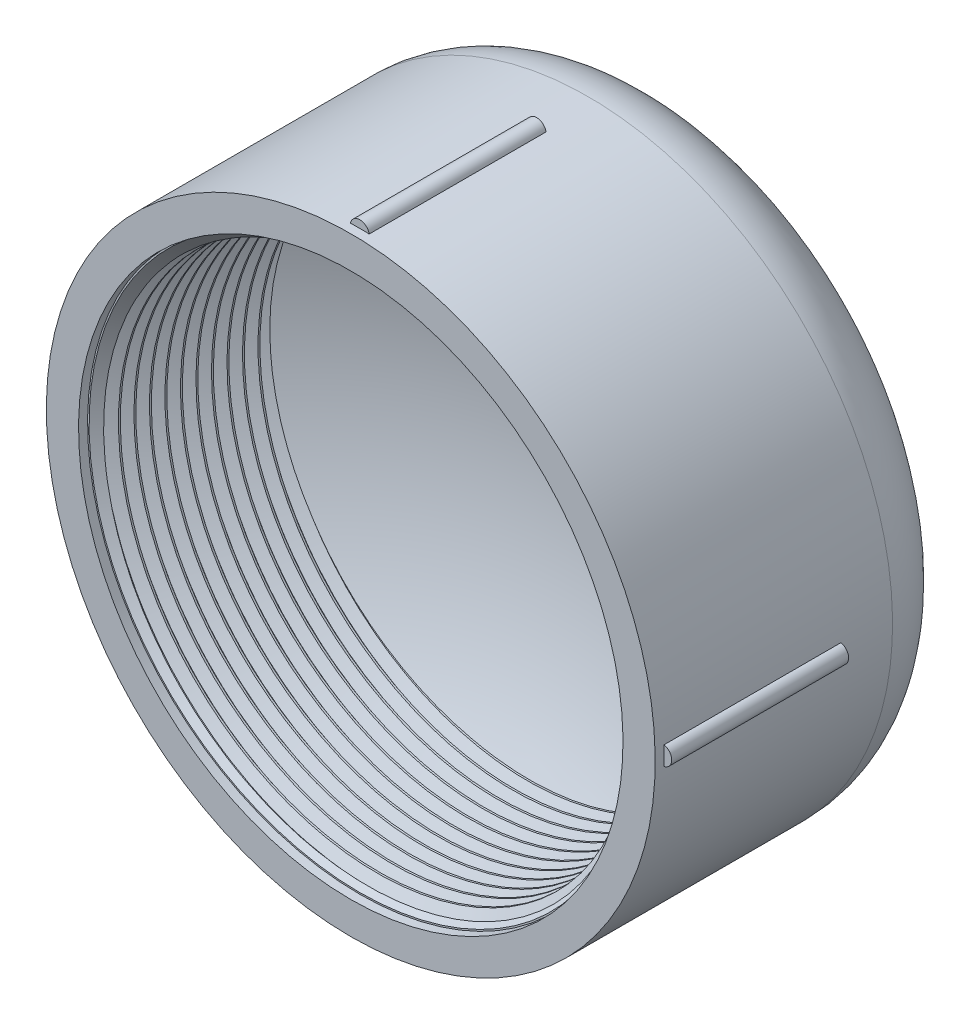
from build123d import *

# Parameters (mm, degrees)
FILLET1_R              = 15.875
BOSS_EXTRUDE1_START    = -37.338
BOSS_EXTRUDE1_DEPTH    = 37.338
CIRPATTERN1_COUNT      = 4
SKETCH5_R              = 57.4675
BOSS_EXTRUDE2_DEPTH    = 35.433
SKETCH6_R              = 57.15
BOSS_EXTRUDE3_DEPTH    = 35.433
BOSS_EXTRUDE3_DRAFT    = -1.783333333
CUT_SWEEP1_PITCH       = 3.17653854
CUT_SWEEP1_HEIGHT      = 39.116
CUT_SWEEP1_RADIUS      = 57.15
CUT_SWEEP1_START_ANGLE = 90


with BuildPart() as part:
    # Sketch2 → Revolve1 (revolve)
    with BuildSketch(Plane(origin=(0, 0, 0), x_dir=(0, 0, -1), z_dir=(1, 0, 0))):
        with BuildLine():
            Line((-37.719, -64.262), (22.6314, -64.262))
            ThreePointArc((22.6314, -64.262), (33.89650561, -33.004697839), (37.719, 0))
            Line((37.719, 0), (14.143642192, 0))
            ThreePointArc((14.143642192, 0), (10.696674637, -28.654184307), (0.55245, -55.673410242))
            Line((0.55245, -55.673410242), (-0.381, -55.673410242))
            Line((-0.381, -55.673410242), (-0.381, -56.046790242))
            Line((-0.381, -56.046790242), (-35.814, -57.15))
            Line((-35.814, -57.15), (-35.814, -57.4675))
            Line((-35.814, -57.4675), (-37.719, -57.4675))
            Line((-37.719, -57.4675), (-37.719, -64.262))
        make_face()
    revolve(axis=Axis((0, 0, 37.719), (0, 0, -1)))

    # Fillet1
    fillet1_edges = [part.edges().sort_by_distance(p)[0] for p in [
        (0, 64.262, -22.6314),
    ]]
    fillet(fillet1_edges, radius=FILLET1_R)

    # Sketch4 → Boss-Extrude1 (add)
    with BuildSketch(Plane.XY.offset(35.814).offset(BOSS_EXTRUDE1_START)):
        with BuildLine():
            ThreePointArc((1.984375, 64.231354492), (0, 64.262), (-1.984375, 64.231354492))
            ThreePointArc((-1.984375, 64.231354492), (0, 65.8495), (1.984375, 64.231354492))
        make_face()
    boss_extrude1 = extrude(amount=BOSS_EXTRUDE1_DEPTH)

    # CirPattern1: Boss-Extrude1 ×4 about axis
    cirpattern1_axis = Axis((0, 0, 0), (0, 0, 1))
    for i in range(1, CIRPATTERN1_COUNT):
        add(boss_extrude1.rotate(cirpattern1_axis, i * 360 / CIRPATTERN1_COUNT))

    # Sketch5 → Boss-Extrude2 (add)
    with BuildSketch(Plane.XY.offset(35.814)):
        with Locations(Location((0, 0, 0), (0, 0, 270))):
            Circle(SKETCH5_R)
    extrude(amount=-BOSS_EXTRUDE2_DEPTH)


with BuildPart() as body_2:
    # Sketch6 → Boss-Extrude3 (with draft: the straight prism first)
    with BuildSketch(Plane.XY.offset(35.814)):
        Circle(SKETCH6_R)
    extrude(amount=-BOSS_EXTRUDE3_DEPTH)
    # Boss-Extrude3: the draft: its side faces are tilted about the plane it starts from
    boss_extrude3_sides = [body_2.faces().sort_by_distance(p)[0] for p in [
        (-57.15, 0, 18.0975),
    ]]
    draft(boss_extrude3_sides, Plane.XY.offset(35.814), BOSS_EXTRUDE3_DRAFT)

    # Cut-Sweep1: sweep along a helix
    with BuildLine() as cut_sweep1_path:
        # a taper helix: rise per turn along the axis 3.175, along the cone's slant (build123d's pitch) 3.17653854
        add(Helix(CUT_SWEEP1_PITCH, CUT_SWEEP1_HEIGHT, CUT_SWEEP1_RADIUS, center=(0, 0, 35.814), direction=(0, 0, -1), cone_angle=-1.783333333, mode=Mode.PRIVATE).rotate(Axis((0, 0, 35.814), (0, 0, -1)), CUT_SWEEP1_START_ANGLE))
    # Sketch8 → Cut-Sweep1 (sweep, cut)
    with BuildSketch(Plane(origin=(0, 0, 0), x_dir=(0, 0, -1), z_dir=(1, 0, 0))):
        Polygon((-37.4015, 55.087777007), (-37.004625, 55.087777007), (-34.623375, 59.212222993), (-39.78275, 59.212222993), align=None)
    sweep(path=cut_sweep1_path.line, is_frenet=True, mode=Mode.SUBTRACT)


with BuildPart() as part_1:
    add(part.part)

    # Combine1: cut body 2
    add(body_2.part, mode=Mode.SUBTRACT)

    # Sketch9 → Cut-Revolve1 (revolve, cut)
    with BuildSketch(Plane(origin=(0, 0, 0), x_dir=(0, 0, -1), z_dir=(1, 0, 0)), mode=Mode.PRIVATE) as cut_revolve1_sk:
        Polygon((-35.814, 57.15), (-30.576777007, 51.912777007), (-35.814, 51.912777007), align=None)
    revolve(cut_revolve1_sk.sketch.rotate(Axis((0, 0, 37.719), (0, 0, -1)), 180), axis=Axis((0, 0, 37.719), (0, 0, -1)), mode=Mode.SUBTRACT)


solid = part_1.part
